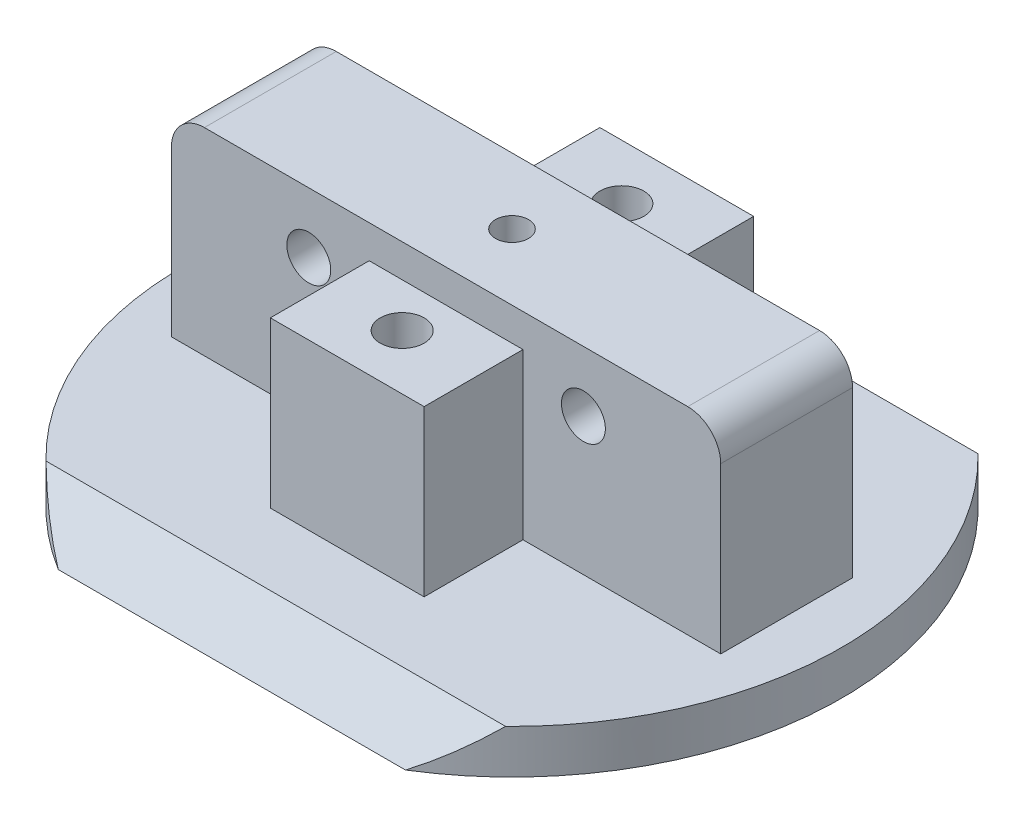
from build123d import *
from build123d.topology import SkipClean

# Parameters (mm, degrees)
SKETCH1_R                            = 30
BOSS_EXTRUDE1_DEPTH                  = 4
BOSS_EXTRUDE2_REACH                  = 44.615
BOSS_EXTRUDE2_END_RADIUS             = 30
BOSS_EXTRUDE2_DIRECTION_2_REACH      = 44.615
BOSS_EXTRUDE2_DIRECTION_2_END_RADIUS = 30
SKETCH3_OUTSIDE_W                    = 78.092
SKETCH3_OUTSIDE_H                    = 69.092
SKETCH3_OUTSIDE_R                    = 21.5
CUT_EXTRUDE2_DEPTH                   = 12.5
BOSS_EXTRUDE3_DEPTH                  = 18
BOSS_EXTRUDE4_DEPTH                  = 15
BOSS_EXTRUDE5_DEPTH                  = 15
CUT_EXTRUDE3_DEPTH                   = 44.292609069
CUT_EXTRUDE3_DEPTH_BACK              = 44.292609069
SKETCH8_R                            = 2
CUT_EXTRUDE8_DEPTH                   = 48.077064479
CUT_EXTRUDE8_DEPTH_BACK              = 48.077064479
CUT_EXTRUDE9_DEPTH                   = 59.659818207
CUT_EXTRUDE11_DEPTH                  = 20
CUT_EXTRUDE12_DEPTH                  = 20
CUT_EXTRUDE13_DEPTH                  = 20
CUT_EXTRUDE14_DEPTH                  = 44.292609069
CUT_EXTRUDE14_DEPTH_BACK             = 44.292609069
SKETCH25_W                           = 66.075437062
SKETCH25_H                           = 20.142243048
SKETCH26_R                           = 5
CUT_EXTRUDE15_DEPTH                  = 24
SKETCH27_R                           = 1.5
CUT_EXTRUDE16_DEPTH                  = 30
SKETCH28_R                           = 5
CUT_EXTRUDE17_DEPTH                  = 3
CUT_EXTRUDE18_DEPTH                  = 43.690748412
CUT_EXTRUDE18_DEPTH_BACK             = 43.690748412
SKETCH29_W                           = 43.412566799
SKETCH29_H                           = 13.326200919
SKETCH32_W                           = 50
SKETCH32_H                           = 12
BOSS_EXTRUDE6_DEPTH                  = 18
SKETCH35_W                           = 14
SKETCH35_H                           = 15
BOSS_EXTRUDE7_DEPTH                  = 9
CUT_EXTRUDE19_DEPTH                  = 49.746794766
CUT_EXTRUDE19_DEPTH_BACK             = 49.746794766
SKETCH37_R                           = 2
SKETCH36_R                           = 2
CUT_EXTRUDE20_DEPTH                  = 15
SKETCH39_W                           = 14
SKETCH39_H                           = 15
BOSS_EXTRUDE8_DEPTH                  = 9
SKETCH40_R                           = 2
CUT_EXTRUDE21_DEPTH                  = 10
CUT_EXTRUDE22_START                  = -9
SKETCH41_R                           = 5
CUT_EXTRUDE22_DEPTH                  = 9
CUT_EXTRUDE23_START                  = -9
SKETCH42_R                           = 5
CUT_EXTRUDE23_DEPTH                  = 9
FILLET1_R                            = 3
CUT_EXTRUDE24_START                  = -19
CUT_EXTRUDE24_OUTLINE_R              = 1.5
CUT_EXTRUDE24_DEPTH                  = 19
CUT_EXTRUDE24_START_2                = -7
CUT_EXTRUDE24_2_DEPTH                = 14


with BuildPart() as part:
    # Sketch1 → Boss-Extrude1 (new body)
    with BuildSketch(Plane(origin=(0, 0, 0), x_dir=(1, 0, 0), z_dir=(0, 1, 0))):
        with Locations(Location((0, 0, 0), (0, 0, 270))):
            Circle(SKETCH1_R)
    extrude(amount=BOSS_EXTRUDE1_DEPTH)

    # Boss-Extrude2: up to this cylinder (the profile starts inside it)
    with SkipClean():  # the faces are left unmerged after this step: merging them gives an invalid solid
        boss_extrude2_end = Plane(origin=(0, 9.396175, 0), z_dir=(0, -1, 0)) * Cylinder(BOSS_EXTRUDE2_END_RADIUS, 150.23, mode=Mode.PRIVATE)
        # Sketch2 → Boss-Extrude2 (add, up to the surface)
        with BuildSketch(Plane(origin=(0, 0, 0), x_dir=(0, 0, -1), z_dir=(1, 0, 0)), mode=Mode.PRIVATE) as boss_extrude2_sk1:
            Polygon((0, 4), (21.5, 4), (9, 16.5), (-9, 16.5), (-21.5, 4), align=None)
        boss_extrude2_tool1 = extrude(boss_extrude2_sk1.sketch, amount=BOSS_EXTRUDE2_REACH, mode=Mode.PRIVATE) & boss_extrude2_end
        add(boss_extrude2_tool1.solids().sort_by_distance((0, 9.396175, 0))[0])

    # Boss-Extrude2 direction 2: up to this cylinder (the profile starts inside it)
    with SkipClean():  # the faces are left unmerged after this step: merging them gives an invalid solid
        boss_extrude2_direction_2_end = Plane(origin=(0, 9.396175, 0), z_dir=(0, -1, 0)) * Cylinder(BOSS_EXTRUDE2_DIRECTION_2_END_RADIUS, 150.23, mode=Mode.PRIVATE)
        # Sketch2 → Boss-Extrude2 direction 2 (add, up to the surface)
        with BuildSketch(Plane(origin=(0, 0, 0), x_dir=(0, 0, -1), z_dir=(1, 0, 0)), mode=Mode.PRIVATE) as boss_extrude2_direction_2_sk1:
            Polygon((0, 4), (21.5, 4), (9, 16.5), (-9, 16.5), (-21.5, 4), align=None)
        boss_extrude2_direction_2_tool1 = extrude(boss_extrude2_direction_2_sk1.sketch, amount=-BOSS_EXTRUDE2_DIRECTION_2_REACH, mode=Mode.PRIVATE) & boss_extrude2_direction_2_end
        add(boss_extrude2_direction_2_tool1.solids().sort_by_distance((0, 9.396175, 0))[0])

    # SurfaceCut1
    split(bisect_by=Plane(origin=(0, 12.75, -12.75), x_dir=(1, 0, 0), z_dir=(0, 0.7071067811865558, -0.7071067811865392)), keep=Keep.BOTTOM)

    # SurfaceCut2
    split(bisect_by=Plane(origin=(0, 12.75, 12.75), x_dir=(1, 0, 0), z_dir=(0, 0.7071067811865509, 0.7071067811865442)), keep=Keep.BOTTOM)

    # Sketch3 outside → Cut-Extrude2 (cut)
    with BuildSketch(Plane(origin=(0, 4, 0), x_dir=(1, 0, 0), z_dir=(0, 1, 0))):
        Rectangle(SKETCH3_OUTSIDE_W, SKETCH3_OUTSIDE_H)
        Circle(SKETCH3_OUTSIDE_R, mode=Mode.SUBTRACT)
    extrude(amount=CUT_EXTRUDE2_DEPTH, mode=Mode.SUBTRACT)

    # Sketch5 → Boss-Extrude3 (add)
    with BuildSketch(Plane(origin=(0, 0, 0), x_dir=(-1, 0, 0), z_dir=(0, -1, 0))):
        Polygon((0, -6), (-17.5, -6), (-17.5, 6), (17.5, 6), (17.5, -6), align=None)
    extrude(amount=BOSS_EXTRUDE3_DEPTH)

    # Sketch6 → Boss-Extrude4 (add)
    with BuildSketch(Plane.XZ):
        Polygon((0, 15), (7, 15), (7, 6), (-7, 6), (-7, 15), align=None)
    extrude(amount=BOSS_EXTRUDE4_DEPTH)

    # Sketch7 → Boss-Extrude5 (add)
    with BuildSketch(Plane.XZ):
        Polygon((0, -15), (7, -15), (7, -6), (-7, -6), (-7, -15), align=None)
    extrude(amount=BOSS_EXTRUDE5_DEPTH)

    # Sketch8 → Cut-Extrude3 (cut, two sides: drawn at the far end of the back side and taken through both)
    with BuildSketch(Plane.XY.offset(-CUT_EXTRUDE3_DEPTH_BACK)):
        with Locations((-12.5, -12.5)):
            Circle(SKETCH8_R)
        with Locations((12.5, -12.5)):
            Circle(SKETCH8_R)
    extrude(amount=CUT_EXTRUDE3_DEPTH + CUT_EXTRUDE3_DEPTH_BACK, mode=Mode.SUBTRACT)

    # Sketch16 → Cut-Extrude8 (cut, two sides: drawn at the far end of the back side and taken through both)
    with BuildSketch(Plane.XY.offset(6).offset(-CUT_EXTRUDE8_DEPTH_BACK)):
        Polygon((17.5, -18), (17.5, -14.5), (14, -18), align=None)
        Polygon((-17.5, -18), (-14, -18), (-17.5, -14.5), align=None)
    extrude(amount=CUT_EXTRUDE8_DEPTH + CUT_EXTRUDE8_DEPTH_BACK, mode=Mode.SUBTRACT)

    # Sketch17 → Cut-Extrude9 (cut, through all)
    with BuildSketch(Plane(origin=(10.365975269, -9.674910251, -8.062425209), x_dir=(-0.3613483622370374, 0.337258471421235, -0.8693009171531012), z_dir=(0.6355070151731325, -0.5931398808282571, -0.49428323402354774))):
        Polygon((-2.372510104, -6.189601271), (7.980636686, -0.706686759), (7.980636686, -10.965829024), align=None)
    extrude(amount=CUT_EXTRUDE9_DEPTH, mode=Mode.SUBTRACT)

    # Sketch19 → Cut-Extrude11 (cut)
    with BuildSketch(Plane(origin=(-10.365975269, -9.674910251, -8.062425209), x_dir=(0.3613483622370374, 0.33725847142123494, -0.8693009171531012), z_dir=(0.6355070151731324, 0.5931398808282571, 0.4942832340235476))):
        Polygon((-2.372510104, -6.189601271), (7.980636686, -10.965829024), (7.980636686, -0.706686759), align=None)
    extrude(amount=-CUT_EXTRUDE11_DEPTH, mode=Mode.SUBTRACT)

    # Sketch20 → Cut-Extrude12 (cut)
    with BuildSketch(Plane(origin=(-10.365975269, -9.674910251, 8.062425209), x_dir=(-0.3613483622370374, -0.3372584714212349, -0.8693009171531013), z_dir=(0.6355070151731326, 0.593139880828257, -0.49428323402354757))):
        Polygon((2.372510104, -6.189601271), (-7.980636686, -0.706686759), (-7.980636686, -10.965829024), align=None)
    extrude(amount=-CUT_EXTRUDE12_DEPTH, mode=Mode.SUBTRACT)

    # Sketch21 → Cut-Extrude13 (cut)
    with BuildSketch(Plane(origin=(10.365975269, -9.674910251, 8.062425209), x_dir=(-0.3613483622370374, 0.3372584714212349, 0.8693009171531013), z_dir=(-0.6355070151731326, 0.593139880828257, -0.49428323402354757))):
        Polygon((-2.372510104, -6.189601271), (7.980636686, -0.706686759), (7.980636686, -10.965829024), align=None)
    extrude(amount=-CUT_EXTRUDE13_DEPTH, mode=Mode.SUBTRACT)

    # Sketch25 → Cut-Extrude14 (cut, two sides: drawn at the far end of the back side and taken through both)
    with BuildSketch(Plane.XY.offset(-CUT_EXTRUDE14_DEPTH_BACK)):
        with Locations((0, -10.071121524)):
            Rectangle(SKETCH25_W, SKETCH25_H)
    extrude(amount=CUT_EXTRUDE14_DEPTH + CUT_EXTRUDE14_DEPTH_BACK, mode=Mode.SUBTRACT)

    # Sketch26 → Cut-Extrude15 (cut)
    with BuildSketch(Plane(origin=(0, 16.5, 0), x_dir=(1, 0, 0), z_dir=(0, 1, 0))):
        with Locations(Location((-8, 0, 0), (0, 0, 270))):
            Circle(SKETCH26_R)
        with Locations(Location((8, 0, 0), (0, 0, 270))):
            Circle(SKETCH26_R)
    extrude(amount=-CUT_EXTRUDE15_DEPTH, mode=Mode.SUBTRACT)

    # Sketch27 → Cut-Extrude16 (cut)
    with BuildSketch(Plane(origin=(0, 16.5, 0), x_dir=(1, 0, 0), z_dir=(0, 1, 0))):
        with Locations(Location((0, 0, 0), (0, 0, 270))):
            Circle(SKETCH27_R)
    extrude(amount=-CUT_EXTRUDE16_DEPTH, mode=Mode.SUBTRACT)

    # Sketch28 → Cut-Extrude17 (cut)
    with BuildSketch(Plane.XZ):
        with Locations(Location((0, -15, 0), (0, 0, 270))):
            Circle(SKETCH28_R)
        with Locations(Location((22, 0, 0), (0, 0, 270))):
            Circle(SKETCH28_R)
        with Locations(Location((0, 15, 0), (0, 0, 270))):
            Circle(SKETCH28_R)
        with Locations(Location((-22, 0, 0), (0, 0, 270))):
            Circle(SKETCH28_R)
        with Locations(Location((-14, 12, 0), (0, 0, 270))):
            Circle(SKETCH28_R)
        with Locations(Location((14, 12, 0), (0, 0, 270))):
            Circle(SKETCH28_R)
        with Locations(Location((14, -12, 0), (0, 0, 270))):
            Circle(SKETCH28_R)
        with Locations(Location((-14, -12, 0), (0, 0, 270))):
            Circle(SKETCH28_R)
    extrude(amount=-CUT_EXTRUDE17_DEPTH, mode=Mode.SUBTRACT)

    # Sketch29 → Cut-Extrude18 (cut, two sides: drawn at the far end of the back side and taken through both)
    with BuildSketch(Plane(origin=(0, 0, 0), x_dir=(0, 0, -1), z_dir=(1, 0, 0)).offset(-CUT_EXTRUDE18_DEPTH_BACK)):
        with Locations((0.2062834, 10.66310046)):
            Rectangle(SKETCH29_W, SKETCH29_H)
    extrude(amount=CUT_EXTRUDE18_DEPTH + CUT_EXTRUDE18_DEPTH_BACK, mode=Mode.SUBTRACT)

    # Sketch32 → Boss-Extrude6 (add)
    with BuildSketch(Plane(origin=(0, 4, 0), x_dir=(1, 0, 0), z_dir=(0, 1, 0))):
        Rectangle(SKETCH32_W, SKETCH32_H)
    extrude(amount=BOSS_EXTRUDE6_DEPTH)

    # Sketch35 → Boss-Extrude7 (add)
    with BuildSketch(Plane(origin=(0, 0, -6), x_dir=(-1, 0, 0), z_dir=(0, 0, -1))):
        with Locations((0, 11.5)):
            Rectangle(SKETCH35_W, SKETCH35_H)
    extrude(amount=BOSS_EXTRUDE7_DEPTH)

    # Sketch37 → Cut-Extrude19 (cut, two sides: drawn at the far end of the back side and taken through both)
    with BuildSketch(Plane(origin=(0, 0, -6), x_dir=(-1, 0, 0), z_dir=(0, 0, -1)).offset(-CUT_EXTRUDE19_DEPTH_BACK)):
        with Locations((-12.5, 16.5)):
            Circle(SKETCH37_R)
        with Locations((12.5, 16.5)):
            Circle(SKETCH37_R)
    extrude(amount=CUT_EXTRUDE19_DEPTH + CUT_EXTRUDE19_DEPTH_BACK, mode=Mode.SUBTRACT)

    # Sketch36 → Cut-Extrude20 (cut)
    with BuildSketch(Plane(origin=(0, 19, 0), x_dir=(1, 0, 0), z_dir=(0, 1, 0))):
        with Locations(Location((0, 10, 0), (0, 0, 270))):
            Circle(SKETCH36_R)
    extrude(amount=-CUT_EXTRUDE20_DEPTH, mode=Mode.SUBTRACT)

    # Sketch39 → Boss-Extrude8 (add)
    with BuildSketch(Plane.XY.offset(6)):
        with Locations((0, 11.5)):
            Rectangle(SKETCH39_W, SKETCH39_H)
    extrude(amount=BOSS_EXTRUDE8_DEPTH)

    # Sketch40 → Cut-Extrude21 (cut)
    with BuildSketch(Plane(origin=(0, 19, 0), x_dir=(1, 0, 0), z_dir=(0, 1, 0))):
        with Locations(Location((0, -10, 0), (0, 0, 270))):
            Circle(SKETCH40_R)
    extrude(amount=-CUT_EXTRUDE21_DEPTH, mode=Mode.SUBTRACT)

    # Sketch41 → Cut-Extrude22 (cut)
    with BuildSketch(Plane.XZ.offset(-4).offset(CUT_EXTRUDE22_START)):
        with Locations(Location((-8, 0, 0), (0, 0, 90))):
            Circle(SKETCH41_R)
    extrude(amount=CUT_EXTRUDE22_DEPTH, mode=Mode.SUBTRACT)

    # Sketch42 → Cut-Extrude23 (cut)
    with BuildSketch(Plane.XZ.offset(-4).offset(CUT_EXTRUDE23_START)):
        with Locations(Location((8, 0, 0), (0, 0, 90))):
            Circle(SKETCH42_R)
    extrude(amount=CUT_EXTRUDE23_DEPTH, mode=Mode.SUBTRACT)

    # Fillet1
    fillet1_edges = [part.edges().sort_by_distance(p)[0] for p in [
        (25, 22, 0),
    ]]
    fillet(fillet1_edges, radius=FILLET1_R)

    # Cut-Extrude24: read off the stored shape, not the designer's step
    # Cut-Extrude24 outline → Cut-Extrude24 (cut)
    with BuildSketch(Plane.XZ.offset(-4).offset(CUT_EXTRUDE24_START)):
        Circle(CUT_EXTRUDE24_OUTLINE_R)
    extrude(amount=CUT_EXTRUDE24_DEPTH, mode=Mode.SUBTRACT)

    # Cut-Extrude24 2 outline → Cut-Extrude24 2 (cut)
    with BuildSketch(Plane.XY.offset(CUT_EXTRUDE24_START_2)):
        with BuildLine():
            Line((-25, 22), (-25, 19))
            ThreePointArc((-25, 19), (-24.121320344, 21.121320344), (-22, 22))
            Line((-22, 22), (-25, 22))
        make_face()
    extrude(amount=CUT_EXTRUDE24_2_DEPTH, mode=Mode.SUBTRACT)


solid = part.part
